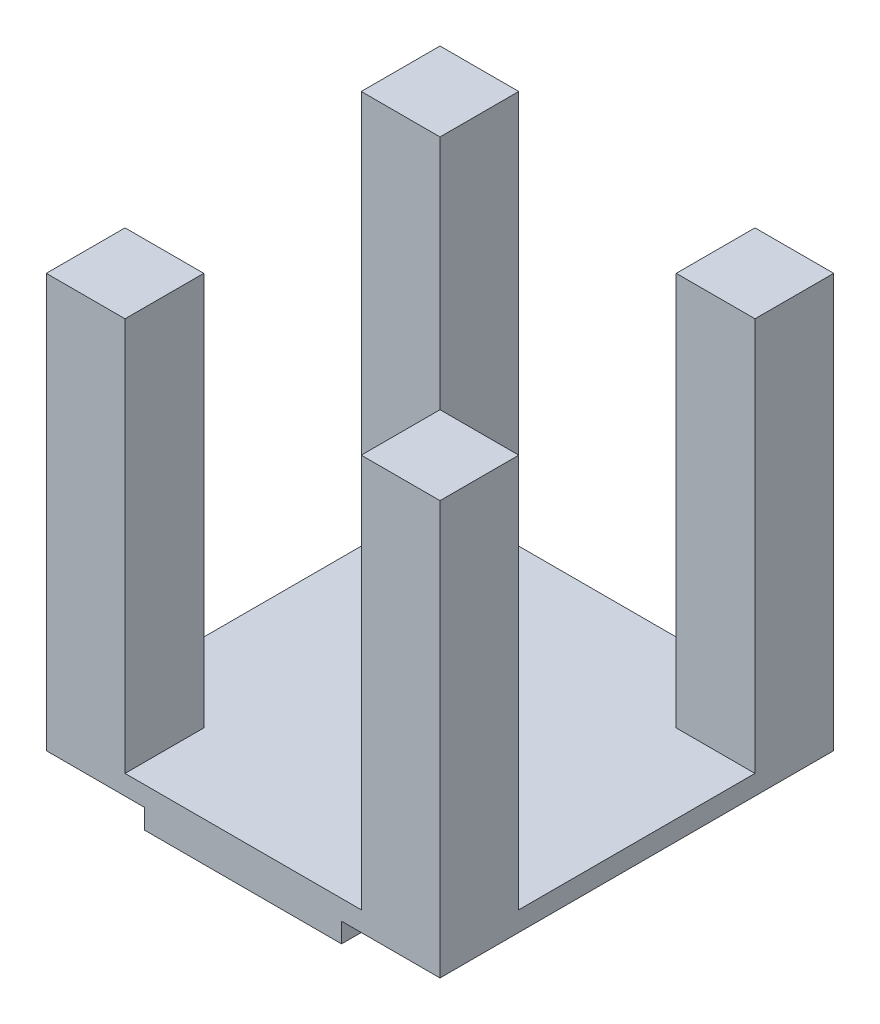
from build123d import *

# Parameters (mm, degrees)
SKETCH1_W                                  = 1000
SKETCH1_H                                  = 1000
BOSS_EXTRUDE1_DEPTH                        = 50
SKETCH2_W                                  = 200
SKETCH2_H                                  = 200
BOSS_EXTRUDE2_DEPTH                        = 1000
MIRROR2_AT_THE_SECOND_PLANE_COPY_1_SKETC_W = 200
MIRROR2_AT_THE_SECOND_PLANE_COPY_1_SKETC_H = 200
MIRROR2_AT_THE_SECOND_PLANE_COPY_1_DEPTH   = 1000
SKETCH4_W                                  = 500
SKETCH4_H                                  = 500
BOSS_EXTRUDE4_DEPTH                        = 50


with BuildPart() as part:
    # Sketch1 → Boss-Extrude1 (new body)
    with BuildSketch(Plane(origin=(0, 0, 0), x_dir=(1, 0, 0), z_dir=(0, 1, 0))):
        Rectangle(SKETCH1_W, SKETCH1_H)
    extrude(amount=BOSS_EXTRUDE1_DEPTH)

    # Sketch2 → Boss-Extrude2 (add)
    with BuildSketch(Plane(origin=(0, 50, 0), x_dir=(1, 0, 0), z_dir=(0, 1, 0))):
        with Locations((-400, 400)):
            Rectangle(SKETCH2_W, SKETCH2_H)
    boss_extrude2 = extrude(amount=BOSS_EXTRUDE2_DEPTH)

    # Mirror1: Boss-Extrude2 across plane
    add(boss_extrude2.mirror(Plane.XY))

    # Mirror2: Boss-Extrude2 across plane
    add(boss_extrude2.mirror(Plane.XY))

    # Mirror2 at the second plane: Boss-Extrude2 across plane
    add(boss_extrude2.mirror(Plane(origin=(0, 0, 0), x_dir=(0, 0, 1), z_dir=(1, 0, 0))))

    # Mirror2 at the second plane copy 1 sketc → Mirror2 at the second plane copy 1 (add)
    with BuildSketch(Plane(origin=(0, 50, 0), x_dir=(-1, 0, 0), z_dir=(0, 1, 0))):
        with Locations((-400, 400)):
            Rectangle(MIRROR2_AT_THE_SECOND_PLANE_COPY_1_SKETC_W, MIRROR2_AT_THE_SECOND_PLANE_COPY_1_SKETC_H)
    extrude(amount=MIRROR2_AT_THE_SECOND_PLANE_COPY_1_DEPTH)

    # Sketch4 → Boss-Extrude4 (add)
    with BuildSketch(Plane.XZ):
        with Locations((0, 250)):
            Rectangle(SKETCH4_W, SKETCH4_H)
    extrude(amount=BOSS_EXTRUDE4_DEPTH)


solid = part.part
